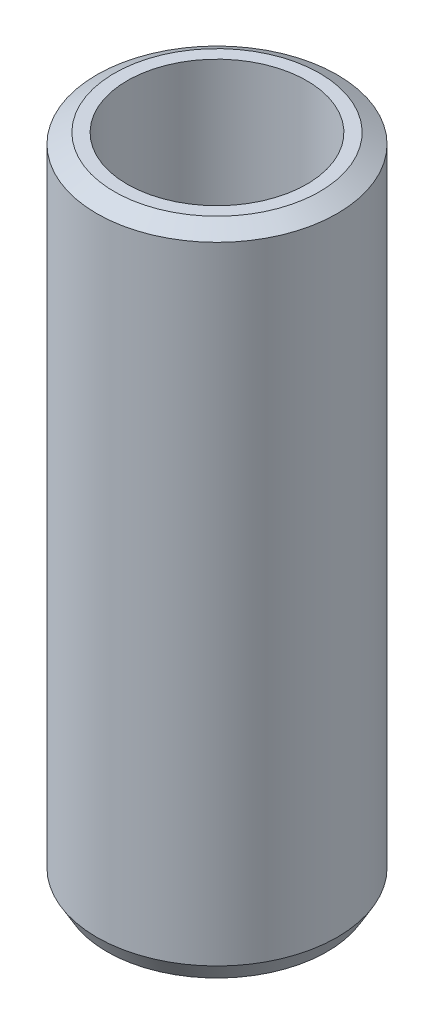
from build123d import *
from OCP.BRepFilletAPI import BRepFilletAPI_MakeChamfer

# Parameters (mm, degrees)
SKETCH1_R           = 20
BOSS_EXTRUDE1_DEPTH = 108.857491613
SKETCH2_R           = 14.931523231
CUT_EXTRUDE1_DEPTH  = 113.472011986
CHAMFER1_SIZE       = 1.690743989
CHAMFER1_SIZE2      = 2.928454491


with BuildPart() as part:
    # Sketch1 → Boss-Extrude1 (new body)
    with BuildSketch(Plane(origin=(0, 0, 0), x_dir=(1, 0, 0), z_dir=(0, 1, 0))):
        Circle(SKETCH1_R)
    extrude(amount=BOSS_EXTRUDE1_DEPTH)

    # Sketch2 → Cut-Extrude1 (cut, through all)
    with BuildSketch(Plane(origin=(0, 0, 0), x_dir=(1, 0, 0), z_dir=(0, 1, 0))):
        Circle(SKETCH2_R)
    extrude(amount=CUT_EXTRUDE1_DEPTH, mode=Mode.SUBTRACT)

    # Chamfer1: one chamfer whose edges measure the first distance from different faces: ONE call of the kernel's chamfer builder (chamfer() names one face for all edges)
    chamfer1_edges_1 = [part.edges().sort_by_distance(p)[0] for p in [
        (-20, 108.857491613, 0),
    ]]
    chamfer1_side_1 = [part.faces().sort_by_distance(p)[0] for p in [
        (-20, 54.428745806, 0),
    ]]
    chamfer1_edges_2 = [part.edges().sort_by_distance(p)[0] for p in [
        (-20, 0, 0),
    ]]
    chamfer1_side_2 = [part.faces().sort_by_distance(p)[0] for p in [
        (-19.434314575, 0, 0),
    ]]
    chamfer1 = BRepFilletAPI_MakeChamfer(part.part.solid().wrapped)
    for e in chamfer1_edges_1:
        chamfer1.Add(CHAMFER1_SIZE, CHAMFER1_SIZE2, e.wrapped, chamfer1_side_1[0].wrapped)  # the first distance lies on this face
    for e in chamfer1_edges_2:
        chamfer1.Add(CHAMFER1_SIZE, CHAMFER1_SIZE2, e.wrapped, chamfer1_side_2[0].wrapped)  # the first distance lies on this face
    add(Compound.cast(chamfer1.Shape()), mode=Mode.REPLACE)


solid = part.part
